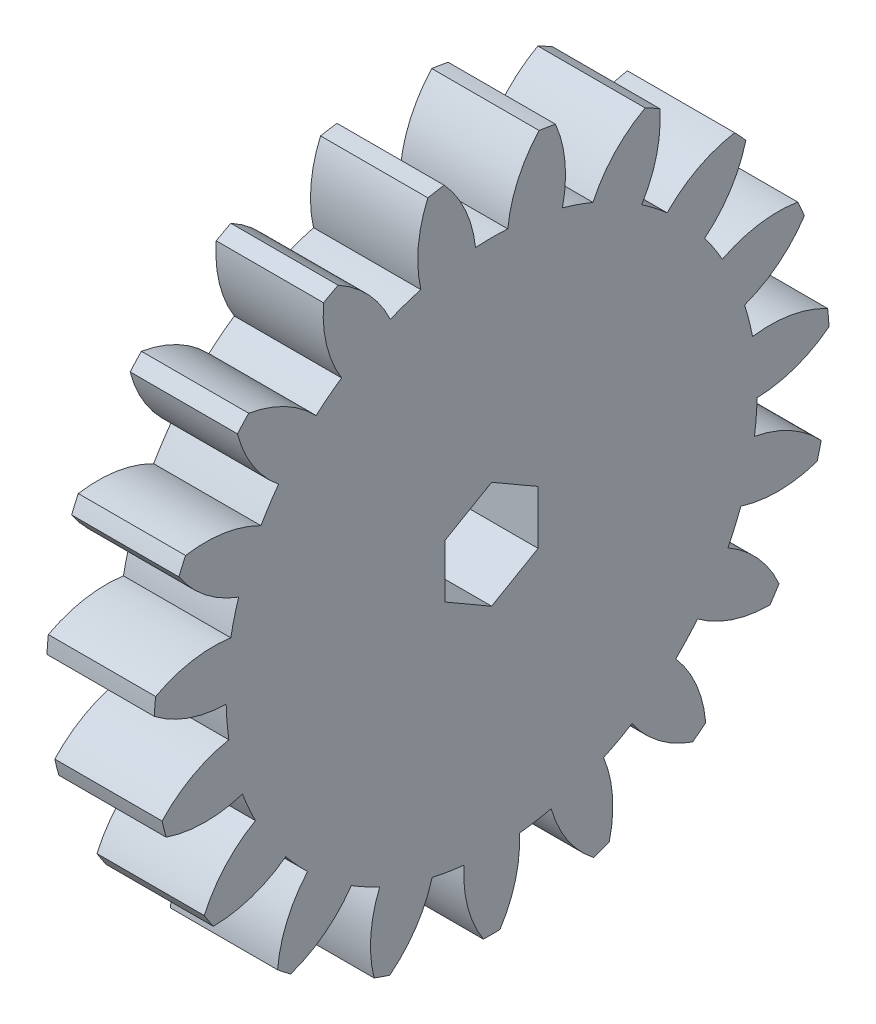
from build123d import *

# Parameters (mm, degrees)
BASPROSKE_W     = 5
BASPROSKE_H     = 15.75
TOOTHCUT_DEPTH  = 23.828162432
TEETHCUTS_COUNT = 19
TEETHCUTS_ANGLE = 341.052631579
BORE_DEPTH      = 50.0000508


with BuildPart() as part:
    # BasProSke → Base-Revolve (revolve)
    with BuildSketch(Plane(origin=(0, 0, 0), x_dir=(1, 0, 0), z_dir=(0, 1, 0))):
        with Locations((2.5, 7.875)):
            Rectangle(BASPROSKE_W, BASPROSKE_H)
    revolve(axis=Axis((-10, 0, 0), (1, 0, 0)))

    # TooCutSke → ToothCut (cut, through all)
    with BuildSketch(Plane(origin=(0, 0, 0), x_dir=(0, 0, -1), z_dir=(1, 0, 0))):
        with BuildLine():
            ThreePointArc((0.751505376, 12.351158475), (0, 12.374), (-0.751505376, 12.351158475))
            ThreePointArc((-0.751505376, 12.351158475), (-1.227741339, 14.103349268), (-2.230855439, 15.616866817))
            ThreePointArc((-2.230855439, 15.616866817), (0, 15.7754), (2.230855439, 15.616866817))
            ThreePointArc((2.230855439, 15.616866817), (1.227741339, 14.103349268), (0.751505376, 12.351158475))
        make_face()
    toothcut = extrude(amount=TOOTHCUT_DEPTH, mode=Mode.SUBTRACT)

    # TeethCuts: ToothCut ×19 about axis
    teethcuts_axis = Axis((-10, 0, 0), (1, 0, 0))
    for i in range(1, TEETHCUTS_COUNT):
        add(toothcut.rotate(teethcuts_axis, i * TEETHCUTS_ANGLE / (TEETHCUTS_COUNT - 1)), mode=Mode.SUBTRACT)

    # BorSke → Bore (cut, symmetric)
    with BuildSketch(Plane(origin=(0, 0, 0), x_dir=(0, 0, -1), z_dir=(1, 0, 0))):
        Polygon((0, 2.5), (-2.165063509, 1.25), (-2.165063509, -1.25), (0, -2.5), (2.165063509, -1.25), (2.165063509, 1.25), align=None)
    extrude(amount=BORE_DEPTH, both=True, mode=Mode.SUBTRACT)


solid = part.part
